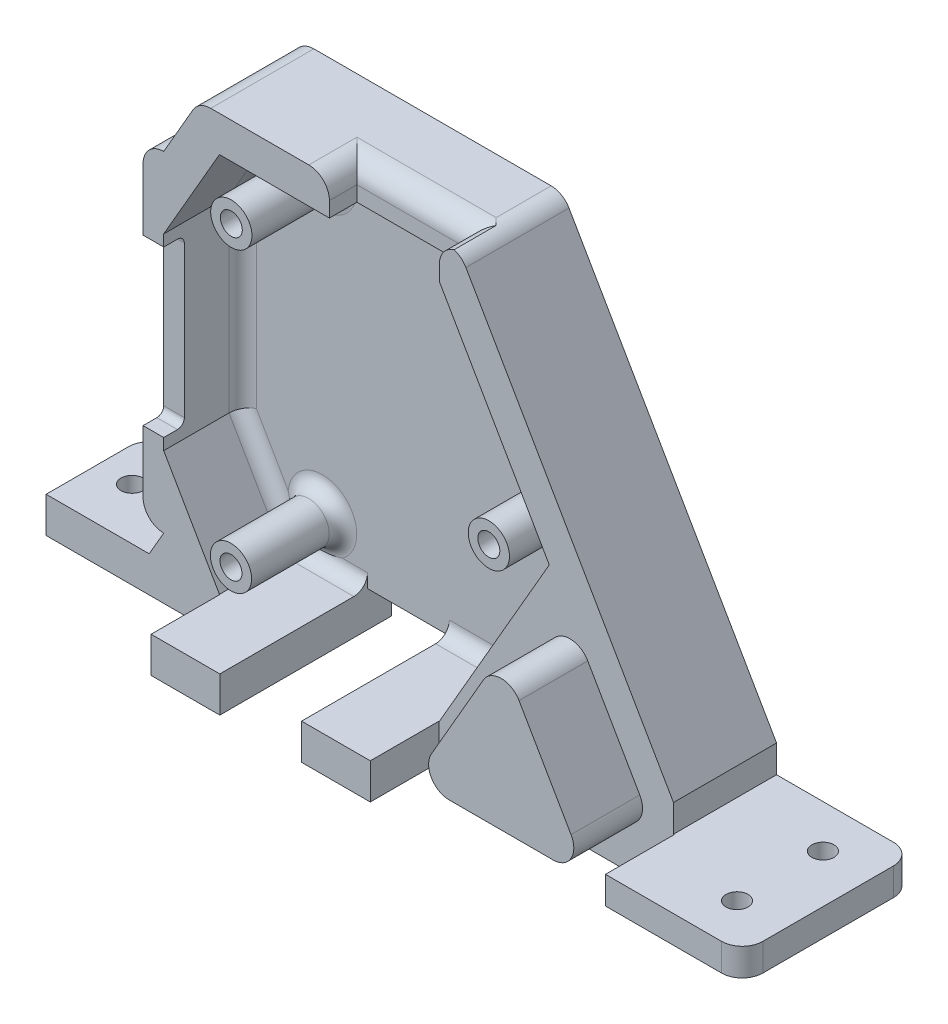
from build123d import *

# Parameters (mm, degrees)
BOSS_EXTRU_1_DEPTH                                 = 15
ENL_V_MAT_EXTRU_1_DEPTH                            = 11.5
ESQUISSE3_R                                        = 3
BOSS_EXTRU_2_DEPTH                                 = 13.3
CHAMBRAGE_POUR_VIS_T_TE_RONDE_BOMB_E_M_D           = 3.2
CHAMBRAGE_POUR_VIS_T_TE_RONDE_BOMB_E_M_CBORE_D     = 7
CHAMBRAGE_POUR_VIS_T_TE_RONDE_BOMB_E_M_CBORE_DEPTH = 2.4
ENL_V_MAT_EXTRU_2_DEPTH                            = 52.998942297
ENL_V_MAT_EXTRU_2_DEPTH_BACK                       = 52.998942297
ESQUISSE6_W                                        = 26.083668392
ESQUISSE6_H                                        = 65.817930688
BOSS_EXTRU_3_DEPTH                                 = 15
ESQUISSE8_W                                        = 10
ESQUISSE8_H                                        = 5.196152423
ESQUISSE8_W_2                                      = 19.9
ESQUISSE8_H_2                                      = 4
BOSS_EXTRU_4_DEPTH                                 = 10
BOSS_EXTRU_5_DEPTH                                 = 10
ESQUISSE13_W                                       = 11.9
ESQUISSE13_H                                       = 5.196152423
ENL_V_MAT_EXTRU_3_DEPTH                            = 15
ESQUISSE14_W                                       = 16
ESQUISSE14_H                                       = 5.196152423
ENL_V_MAT_EXTRU_4_DEPTH                            = 4
BOSS_EXTRU_6_DEPTH                                 = 15
D_GAGEMENT_M32_D                                   = 3.2
D_GAGEMENT_M33_D                                   = 3.2
BOSS_EXTRU_7_DEPTH                                 = 3
CONG_1_R                                           = 3
CONG_2_R                                           = 1
CONG_3_R                                           = 2


with BuildPart() as part:
    # Esquisse1 → Boss.-Extru.1 (new body)
    with BuildSketch(Plane.XY):
        Polygon((38, 0), (19, 32.908965344), (-19, 32.908965344), (-38, 0), (-19, -32.908965344), (19, -32.908965344), align=None)
    extrude(amount=BOSS_EXTRU_1_DEPTH)

    # Esquisse2 → Enlèv. mat.-Extru.1 (cut)
    with BuildSketch(Plane.XY.offset(15)):
        Polygon((32, 0), (16, 27.712812921), (-16, 27.712812921), (-32, 0), (-16, -27.712812921), (16, -27.712812921), align=None)
    extrude(amount=-ENL_V_MAT_EXTRU_1_DEPTH, mode=Mode.SUBTRACT)

    # Esquisse3 → Boss.-Extru.2 (add)
    with BuildSketch(Plane.XY.offset(3.5)):
        with Locations((-12.523357671, -21.637132727)):
            Circle(ESQUISSE3_R)
        with Locations((-12.476627771, 21.664112247)):
            Circle(ESQUISSE3_R)
        with Locations((24.999985442, -0.02697952)):
            Circle(ESQUISSE3_R)
    extrude(amount=BOSS_EXTRU_2_DEPTH)

    # Chambrage pour vis à tête ronde bombée M31 (through all)
    with Locations(Plane(origin=(0, 0, 0), x_dir=(-1, 0, 0), z_dir=(0, 0, -1))):
        with Locations((12.476627771, 21.664112247), (12.523357671, -21.637132727), (-24.999985442, -0.02697952)):
            CounterBoreHole(CHAMBRAGE_POUR_VIS_T_TE_RONDE_BOMB_E_M_D / 2, CHAMBRAGE_POUR_VIS_T_TE_RONDE_BOMB_E_M_CBORE_D / 2, CHAMBRAGE_POUR_VIS_T_TE_RONDE_BOMB_E_M_CBORE_DEPTH)

    # Esquisse6 → Enlèv. mat.-Extru.2 (cut, two sides: drawn at the far end of the back side and taken through both)
    with BuildSketch(Plane.XY.offset(3.5).offset(-ENL_V_MAT_EXTRU_2_DEPTH_BACK)):
        with Locations((-37.15508285, 0)):
            Rectangle(ESQUISSE6_W, ESQUISSE6_H)
    extrude(amount=ENL_V_MAT_EXTRU_2_DEPTH + ENL_V_MAT_EXTRU_2_DEPTH_BACK, mode=Mode.SUBTRACT)

    # Esquisse7 → Boss.-Extru.3 (add)
    with BuildSketch(Plane.XY.offset(15)):
        Polygon((38, 0), (19, -32.908965344), (50.07179677, -32.908965344), (50.07179677, -28.908965344), (70.073047903, -28.908965344), (70.073047903, -24.908965344), (50.07179677, -24.908965344), (50.07179677, -20.908965344), align=None)
    extrude(amount=-BOSS_EXTRU_3_DEPTH)

    # Esquisse8 → Boss.-Extru.4 (add)
    with BuildSketch(Plane.XY.offset(15)):
        with Locations((-10.95, -30.310889133)):
            Rectangle(ESQUISSE8_W, ESQUISSE8_H)
        with Locations((10.95, -30.310889133)):
            Rectangle(ESQUISSE8_W, ESQUISSE8_H)
        with Locations((60.123047903, -26.908965344)):
            Rectangle(ESQUISSE8_W_2, ESQUISSE8_H_2)
    extrude(amount=BOSS_EXTRU_4_DEPTH)

    # Esquisse12 → Boss.-Extru.5 (add)
    with BuildSketch(Plane.XY.offset(15)):
        Polygon((47.762395693, -26.908965344), (35, -4.803847577), (22.237604307, -26.908965344), align=None)
    extrude(amount=BOSS_EXTRU_5_DEPTH)

    # Esquisse13 → Enlèv. mat.-Extru.3 (cut)
    with BuildSketch(Plane.XY.offset(15)):
        with Locations((0, -30.310889133)):
            Rectangle(ESQUISSE13_W, ESQUISSE13_H)
    extrude(amount=-ENL_V_MAT_EXTRU_3_DEPTH, mode=Mode.SUBTRACT)

    # Esquisse14 → Enlèv. mat.-Extru.4 (cut)
    with BuildSketch(Plane.XY.offset(15)):
        with Locations((8, 30.310889133)):
            Rectangle(ESQUISSE14_W, ESQUISSE14_H)
    extrude(amount=-ENL_V_MAT_EXTRU_4_DEPTH, mode=Mode.SUBTRACT)

    # Esquisse15 → Boss.-Extru.6 (add)
    with BuildSketch(Plane.XY.offset(15)):
        Polygon((-24.113248654, -24.052558883), (-26.224275908, -27.708965344), (-41.224275908, -27.708965344), (-41.224275908, -32.908965344), (-19, -32.908965344), align=None)
    extrude(amount=-BOSS_EXTRU_6_DEPTH)

    # Dégagement M32 (through all)
    with Locations(Plane(origin=(0, -27.708965344, 0), x_dir=(1, 0, 0), z_dir=(0, 1, 0))):
        with Locations((-36.224275908, -7.5)):
            Hole(D_GAGEMENT_M32_D / 2)

    # Dégagement M33 (through all)
    with Locations(Plane(origin=(0, -24.908965344, 0), x_dir=(1, 0, 0), z_dir=(0, 1, 0))):
        with Locations((63.073047903, -6.25), (63.073047903, -18.75)):
            Hole(D_GAGEMENT_M33_D / 2)

    # Esquisse22 → Boss.-Extru.7 (add)
    with BuildSketch(Plane.ZY.offset(24.113248654)):
        Polygon((15, -12), (12, -12), (12, 12), (15, 12), (15, 24.052558883), (0, 24.052558883), (0, -24.052558883), (15, -24.052558883), align=None)
    extrude(amount=BOSS_EXTRU_7_DEPTH)

    # Congé1
    # the kernel refuses this fillet: 3 mm, written as the material it takes off along each edge
    with BuildSketch(Plane(origin=(47.762395693, -26.908965344, 15), x_dir=(-0.4999999999999992, 0.8660254037844389, 0), z_dir=(0, 0, 1)), Plane(origin=(22.237604307, -26.908965344, 15), x_dir=(1, 0, 0), z_dir=(0, 0, 1))) as cong_1_piece_1:
        with BuildLine():
            CenterArc((CONG_1_R * 1.73205080757, CONG_1_R), CONG_1_R, 150, 120)
            Line((CONG_1_R * 0.866025403784, CONG_1_R * 1.5), (0, 0))
            Line((0, 0), (CONG_1_R * 1.73205080757, 0))
        make_face()
    extrude(amount=22.990381057, mode=Mode.SUBTRACT)
    with BuildSketch(Plane(origin=(35, -4.803847577, 15), x_dir=(0.49999999999999956, -0.8660254037844389, 0), z_dir=(0, 0, 1))) as cong_1_piece_2:
        with BuildLine():
            CenterArc((CONG_1_R * 1.73205080757, -CONG_1_R), CONG_1_R, 90, 120)
            Line((CONG_1_R * 0.866025403784, -CONG_1_R * 1.5), (0, 0))
            Line((0, 0), (CONG_1_R * 1.73205080757, 0))
        make_face()
    extrude(amount=22.990381057, mode=Mode.SUBTRACT)
    with BuildSketch(Plane(origin=(-19, 32.908965344, -4.330127019), x_dir=(1, 0, 0), z_dir=(0, 0, 1)), Plane(origin=(19, 32.908965344, -4.330127019), x_dir=(0.500000000000001, -0.866025403784438, 0), z_dir=(0, 0, 1))) as cong_1_piece_3:
        with BuildLine():
            CenterArc((CONG_1_R * 0.57735026919, -CONG_1_R), CONG_1_R, 90, 60)
            Line((-CONG_1_R * 0.288675134595, -CONG_1_R * 0.5), (0, 0))
            Line((0, 0), (CONG_1_R * 0.57735026919, 0))
        make_face()
    extrude(amount=23.660254038, mode=Mode.SUBTRACT)
    with BuildSketch(Plane(origin=(70.073047903, -36.408965344, 0), x_dir=(-1, 0, 0), z_dir=(0, 1, 0))) as cong_1_piece_4:
        with BuildLine():
            CenterArc((CONG_1_R, CONG_1_R), CONG_1_R, 180, 90)
            Line((0, CONG_1_R), (0, 0))
            Line((0, 0), (CONG_1_R, 0))
        make_face()
    extrude(amount=19, mode=Mode.SUBTRACT)
    with BuildSketch(Plane(origin=(70.073047903, -17.408965344, 25), x_dir=(0, 0, -1), z_dir=(0, -1, 0))) as cong_1_piece_5:
        with BuildLine():
            CenterArc((CONG_1_R, -CONG_1_R), CONG_1_R, 90, 90)
            Line((0, -CONG_1_R), (0, 0))
            Line((0, 0), (CONG_1_R, 0))
        make_face()
    extrude(amount=19, mode=Mode.SUBTRACT)
    with BuildSketch(Plane(origin=(16, 32.908965344, 22.5), x_dir=(1, 0, 0), z_dir=(0, 0, -1))) as cong_1_piece_6:
        with BuildLine():
            CenterArc((CONG_1_R, CONG_1_R), CONG_1_R, 180, 90)
            Line((0, CONG_1_R), (0, 0))
            Line((0, 0), (CONG_1_R, 0))
        make_face()
    extrude(amount=11.5, mode=Mode.SUBTRACT)
    with BuildSketch(Plane(origin=(16, 32.908965344, 11), x_dir=(0, 0, -1), z_dir=(-1, 0, 0))) as cong_1_piece_7:
        with BuildLine():
            CenterArc((CONG_1_R, CONG_1_R), CONG_1_R, 180, 90)
            Line((0, CONG_1_R), (0, 0))
            Line((0, 0), (CONG_1_R, 0))
        make_face()
    extrude(amount=16, mode=Mode.SUBTRACT)
    with BuildSketch(Plane(origin=(0, 32.908965344, 22.5), x_dir=(-1, 0, 0), z_dir=(0, 0, -1))) as cong_1_piece_8:
        with BuildLine():
            CenterArc((CONG_1_R, -CONG_1_R), CONG_1_R, 90, 90)
            Line((0, -CONG_1_R), (0, 0))
            Line((0, 0), (CONG_1_R, 0))
        make_face()
    extrude(amount=11.5, mode=Mode.SUBTRACT)
    with BuildSketch(Plane(origin=(-41.224275908, -20.208965344, 0), x_dir=(1, 0, 0), z_dir=(0, -1, 0))) as cong_1_piece_9:
        with BuildLine():
            CenterArc((CONG_1_R, CONG_1_R), CONG_1_R, 180, 90)
            Line((0, CONG_1_R), (0, 0))
            Line((0, 0), (CONG_1_R, 0))
        make_face()
    extrude(amount=20.2, mode=Mode.SUBTRACT)
    with BuildSketch(Plane(origin=(-27.113248654, 24.052558883, 22.5), x_dir=(1, 0, 0), z_dir=(0, 0, -1))) as cong_1_piece_10:
        with BuildLine():
            CenterArc((CONG_1_R, CONG_1_R), CONG_1_R, 180, 90)
            Line((0, CONG_1_R), (0, 0))
            Line((0, 0), (CONG_1_R, 0))
        make_face()
    extrude(amount=30, mode=Mode.SUBTRACT)
    with BuildSketch(Plane(origin=(-27.113248654, -24.052558883, -7.5), x_dir=(1, 0, 0), z_dir=(0, 0, 1))) as cong_1_piece_11_section:
        with BuildLine():
            CenterArc((CONG_1_R, CONG_1_R), CONG_1_R, 180, 90)
            Line((0, CONG_1_R), (0, 0))
            Line((0, 0), (CONG_1_R, 0))
        make_face()
    cong_1_piece_11 = extrude(amount=30, mode=Mode.PRIVATE)
    cong_1_piece_11 = split(cong_1_piece_11, bisect_by=Plane(origin=(-24.399476898, -24.548320744, 7.5), z_dir=(-0.866025403784445, 0.4999999999999892, 0)), keep=Keep.TOP, mode=Mode.PRIVATE)
    add(cong_1_piece_11, mode=Mode.SUBTRACT)
    with BuildSketch(Plane(origin=(23.5, 32.908965344, 11), x_dir=(0, 0, -1), z_dir=(-1, 0, 0))) as cong_1_piece_12a_section:
        with BuildLine():
            CenterArc((CONG_1_R, CONG_1_R), CONG_1_R, 180, 90)
            Line((0, CONG_1_R), (0, 0))
            Line((0, 0), (CONG_1_R, 0))
        make_face()
    cong_1_piece_12a = extrude(amount=23.5, mode=Mode.PRIVATE)
    cong_1_piece_12a = split(cong_1_piece_12a, bisect_by=Plane(origin=(16, 32.229780001, 10.320814657), z_dir=(1, 0, 0)), keep=Keep.TOP, mode=Mode.PRIVATE)
    with BuildSketch(Plane(origin=(16, 32.908965344, 22.5), x_dir=(1, 0, 0), z_dir=(0, 0, -1))) as cong_1_piece_12b_section:
        with BuildLine():
            CenterArc((CONG_1_R, CONG_1_R), CONG_1_R, 180, 90)
            Line((0, CONG_1_R), (0, 0))
            Line((0, 0), (CONG_1_R, 0))
        make_face()
    cong_1_piece_12b = extrude(amount=19, mode=Mode.PRIVATE)
    cong_1_piece_12b = split(cong_1_piece_12b, bisect_by=Plane(origin=(16.679185343, 32.229780001, 11), z_dir=(0, 0, -1)), keep=Keep.TOP, mode=Mode.PRIVATE)
    cong_1_piece_12 = cong_1_piece_12a & cong_1_piece_12b
    add(cong_1_piece_12, mode=Mode.SUBTRACT)
    with BuildSketch(Plane(origin=(0, 32.908965344, 22.5), x_dir=(-1, 0, 0), z_dir=(0, 0, -1))) as cong_1_piece_13a_section:
        with BuildLine():
            CenterArc((CONG_1_R, -CONG_1_R), CONG_1_R, 90, 90)
            Line((0, -CONG_1_R), (0, 0))
            Line((0, 0), (CONG_1_R, 0))
        make_face()
    cong_1_piece_13a = extrude(amount=19, mode=Mode.PRIVATE)
    cong_1_piece_13a = split(cong_1_piece_13a, bisect_by=Plane(origin=(-0.679185343, 32.229780001, 11), z_dir=(0, 0, -1)), keep=Keep.TOP, mode=Mode.PRIVATE)
    with BuildSketch(Plane(origin=(16, 32.908965344, 11), x_dir=(0, 0, -1), z_dir=(-1, 0, 0))) as cong_1_piece_13b_section:
        with BuildLine():
            CenterArc((CONG_1_R, CONG_1_R), CONG_1_R, 180, 90)
            Line((0, CONG_1_R), (0, 0))
            Line((0, 0), (CONG_1_R, 0))
        make_face()
    cong_1_piece_13b = extrude(amount=23.5, mode=Mode.PRIVATE)
    cong_1_piece_13b = split(cong_1_piece_13b, bisect_by=Plane(origin=(0, 32.229780001, 10.320814657), z_dir=(-1, 0, 0)), keep=Keep.TOP, mode=Mode.PRIVATE)
    cong_1_piece_13 = cong_1_piece_13a & cong_1_piece_13b
    add(cong_1_piece_13, mode=Mode.SUBTRACT)

    # Congé2
    cong_2_edges = [part.edges().sort_by_distance(p)[0] for p in [
        (-25.613248654, -12, 12),
        (-25.613248654, 12, 12),
    ]]
    fillet(cong_2_edges, radius=CONG_2_R)

    # Congé3
    # the kernel refuses this fillet: 2 mm, written as the material it adds along each edge
    with BuildSketch(Plane(origin=(5.95, -27.712812921, 3.5), x_dir=(0, 1, 0), z_dir=(1, 0, 0)), Plane(origin=(-21, -27.712812921, 3.5), x_dir=(0, 1, 0), z_dir=(1, 0, 0))) as cong_3_piece_1:
        with BuildLine():
            CenterArc((CONG_3_R, CONG_3_R), CONG_3_R, 180, 90)
            Line((0, CONG_3_R), (0, 0))
            Line((0, 0), (CONG_3_R, 0))
        make_face()
    extrude(amount=15.05)
    with BuildSketch(Plane(origin=(13.5, -32.04293994, 3.5), x_dir=(-0.8660254037844388, 0.49999999999999994, 0), z_dir=(0.4999999999999999, 0.8660254037844387, 0)), Plane(origin=(21, 27.712812921, 3.5), x_dir=(0, -1, 0), z_dir=(-1, 0, 0)), Plane(origin=(34.5, -4.330127019, 3.5), x_dir=(-0.8660254037844385, -0.5000000000000004, 0), z_dir=(-0.5000000000000004, 0.8660254037844385, 0))) as cong_3_piece_2:
        with BuildLine():
            CenterArc((CONG_3_R, CONG_3_R), CONG_3_R, 180, 90)
            Line((0, CONG_3_R), (0, 0))
            Line((0, 0), (CONG_3_R, 0))
        make_face()
    extrude(amount=42)
    with BuildSketch(Plane(origin=(-13.5, 32.04293994, 3.5), x_dir=(0, 0, 1), z_dir=(-0.4999999999999998, -0.8660254037844389, 0))) as cong_3_piece_3:
        with BuildLine():
            CenterArc((CONG_3_R, -CONG_3_R), CONG_3_R, 90, 90)
            Line((0, -CONG_3_R), (0, 0))
            Line((0, 0), (CONG_3_R, 0))
        make_face()
    extrude(amount=26.226497308)
    with BuildSketch(Plane(origin=(-12.523357671, -21.637132727, 3.5), x_dir=(1, 0, 0), z_dir=(0, -1, 0))) as cong_3_piece_4:
        with BuildLine():
            CenterArc((3 + CONG_3_R, CONG_3_R), CONG_3_R, 180, 90)
            Line((3, CONG_3_R), (3, 0))
            Line((3, 0), (3 + CONG_3_R, 0))
        make_face()
    revolve(axis=Axis((-12.523357671, -21.637132727, 3.5), (0, 0, 1)))
    with BuildSketch(Plane(origin=(-12.476627771, 21.664112247, 3.5), x_dir=(1, 0, 0), z_dir=(0, -1, 0))) as cong_3_piece_5:
        with BuildLine():
            CenterArc((3 + CONG_3_R, CONG_3_R), CONG_3_R, 180, 90)
            Line((3, CONG_3_R), (3, 0))
            Line((3, 0), (3 + CONG_3_R, 0))
        make_face()
    revolve(axis=Axis((-12.476627771, 21.664112247, 3.5), (0, 0, 1)))
    with BuildSketch(Plane(origin=(24.999985442, -0.02697952, 3.5), x_dir=(1, 0, 0), z_dir=(0, -1, 0))) as cong_3_piece_6:
        with BuildLine():
            CenterArc((3 + CONG_3_R, CONG_3_R), CONG_3_R, 180, 90)
            Line((3, CONG_3_R), (3, 0))
            Line((3, 0), (3 + CONG_3_R, 0))
        make_face()
    revolve(axis=Axis((24.999985442, -0.02697952, 3.5), (0, 0, 1)))
    with BuildSketch(Plane(origin=(-26.613248654, -9.330127019, 3.5), x_dir=(0.8660254037844387, 0.4999999999999998, 0), z_dir=(0.4999999999999999, -0.8660254037844388, 0))) as cong_3_piece_7:
        with BuildLine():
            CenterArc((CONG_3_R, CONG_3_R), CONG_3_R, 180, 90)
            Line((0, CONG_3_R), (0, 0))
            Line((0, 0), (CONG_3_R, 0))
        make_face()
    extrude(amount=26.226497308)
    with BuildSketch(Plane(origin=(-24.113248654, -18.660254038, 3.5), x_dir=(0, 0, 1), z_dir=(0, 1, 0))) as cong_3_piece_8:
        with BuildLine():
            CenterArc((CONG_3_R, CONG_3_R), CONG_3_R, 180, 90)
            Line((0, CONG_3_R), (0, 0))
            Line((0, 0), (CONG_3_R, 0))
        make_face()
    extrude(amount=37.320508076)


solid = part.part
